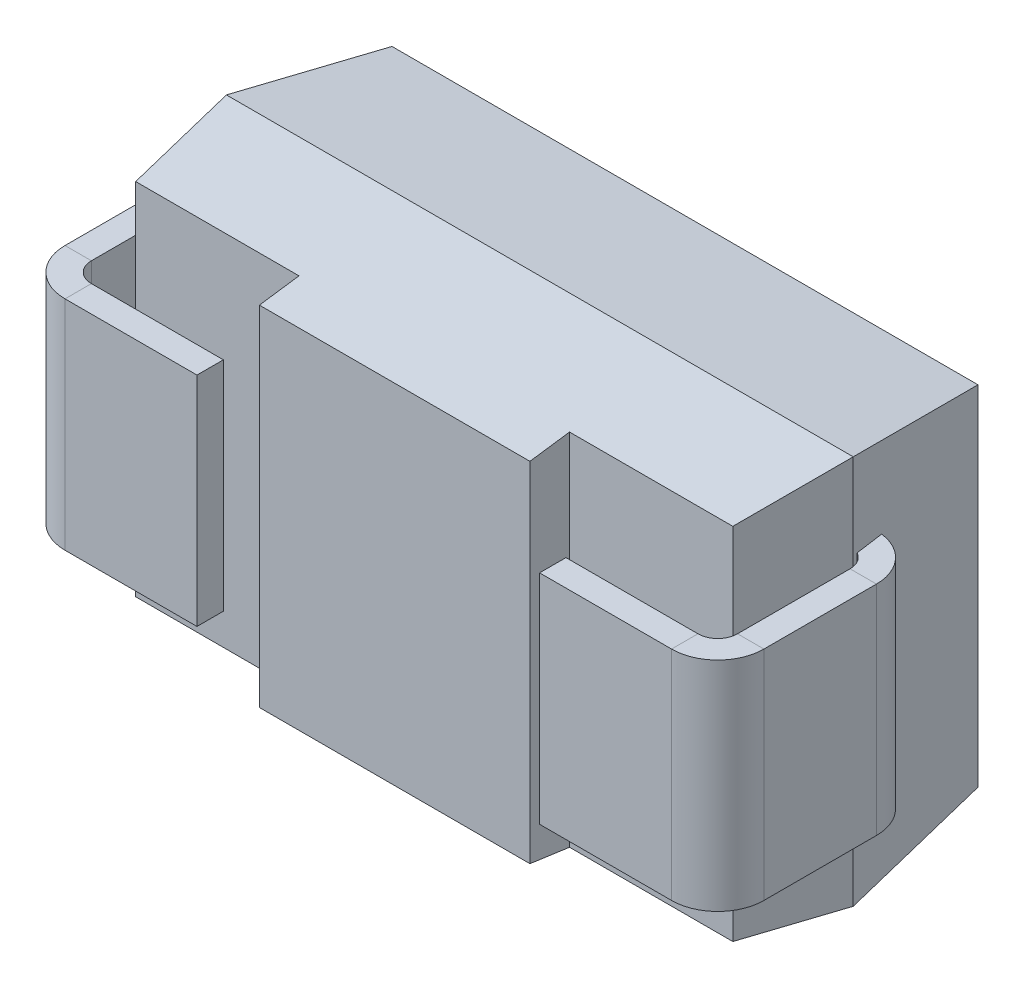
from build123d import *

# Parameters (mm, degrees)
SKETCH1_W                     = 4.75
SKETCH1_H                     = 2.95
BOSS_EXTRUDE1_DEPTH           = 1.1
BOSS_EXTRUDE1_TAPER           = 8
BOSS_EXTRUDE1_OTHER_WAY_DEPTH = 1.1
BOSS_EXTRUDE1_OTHER_WAY_TAPER = 8
SKETCH3_W                     = 1.787084683
SKETCH3_H                     = 3.398135214
SKETCH3_W_2                   = 1.719767091
CUT_EXTRUDE2_DEPTH            = 0.3
BASE_FLANGE1_DEPTH            = 0.825
BASE_FLANGE1_DEPTH_BACK       = 0.825


# Sheet-metal steps are written as plain solids
with BuildPart() as part:
    # Sketch1 → Boss-Extrude1 (new body)
    with BuildSketch(Plane.XY):
        Rectangle(SKETCH1_W, SKETCH1_H)
    extrude(amount=BOSS_EXTRUDE1_DEPTH, taper=BOSS_EXTRUDE1_TAPER)

    # Sketch1 → Boss-Extrude1 other way (add)
    with BuildSketch(Plane.XY):
        Rectangle(SKETCH1_W, SKETCH1_H)
    extrude(amount=-BOSS_EXTRUDE1_OTHER_WAY_DEPTH, taper=BOSS_EXTRUDE1_OTHER_WAY_TAPER)

    # Sketch3 → Cut-Extrude2 (cut)
    with BuildSketch(Plane.XY.offset(1.1)):
        with Locations((1.918542342, 0.018295727)):
            Rectangle(SKETCH3_W, SKETCH3_H)
        with Locations((-1.884883546, 0.018295727)):
            Rectangle(SKETCH3_W_2, SKETCH3_H)
    extrude(amount=-CUT_EXTRUDE2_DEPTH, mode=Mode.SUBTRACT)


with BuildPart() as body_2:
    # Sketch4 → Base-Flange1 (new, two sides: drawn at the far end of the back side and taken through both)
    with BuildSketch(Plane(origin=(0, 0, 0), x_dir=(1, 0, 0), z_dir=(0, 1, 0)).offset(-BASE_FLANGE1_DEPTH_BACK)):
        with BuildLine():
            Line((2.014642842, 0.252838218), (2.298133825, 0.252838218))
            ThreePointArc((2.298133825, 0.252838218), (2.545621198, 0.150325591), (2.648133825, -0.097161782))
            Line((2.648133825, -0.097161782), (2.648133825, -0.95))
            ThreePointArc((2.648133825, -0.95), (2.545621198, -1.197487373), (2.298133825, -1.3))
            Line((2.298133825, -1.3), (1.298133825, -1.3))
            Line((1.298133825, -1.3), (1.298133825, -1.1))
            Line((1.298133825, -1.1), (2.298133825, -1.1))
            ThreePointArc((2.298133825, -1.1), (2.404199842, -1.056066017), (2.448133825, -0.95))
            Line((2.448133825, -0.95), (2.448133825, -0.097161782))
            ThreePointArc((2.448133825, -0.097161782), (2.404199842, 0.008904235), (2.298133825, 0.052838218))
            Line((2.298133825, 0.052838218), (2.014642842, 0.052838218))
            Line((2.014642842, 0.052838218), (2.014642842, 0.252838218))
        make_face()
    extrude(amount=BASE_FLANGE1_DEPTH + BASE_FLANGE1_DEPTH_BACK)


with BuildPart() as body_3:
    # Mirror1: mirrored copy
    add(body_2.part.mirror(Plane.ZY))


solid = Compound([part.part, body_2.part, body_3.part])
